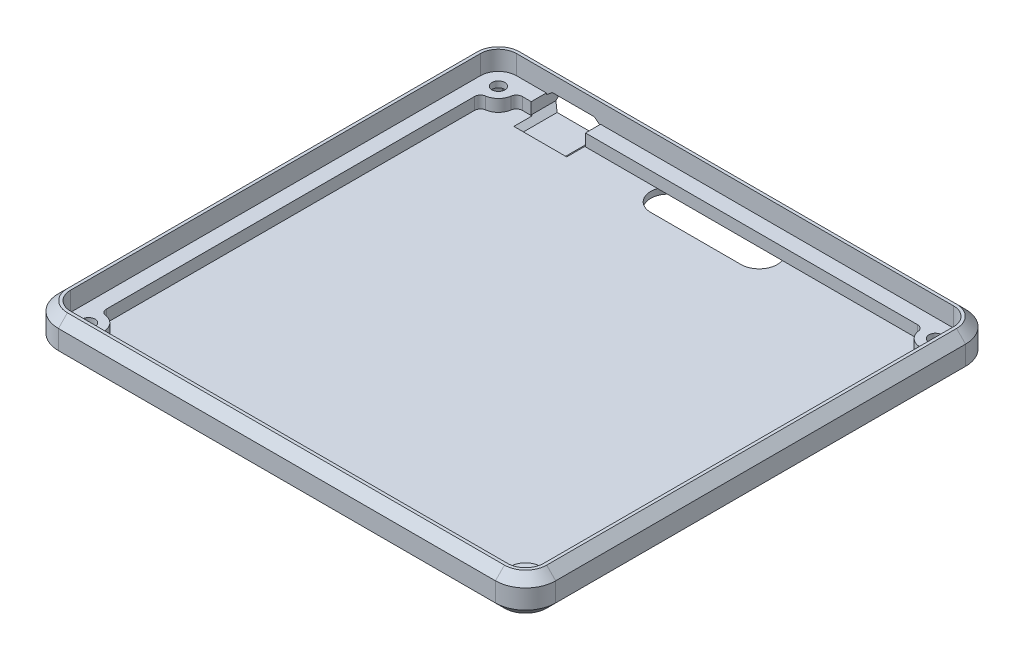
from build123d import *

# Parameters (mm, degrees)
BOSS_EXTRUDE2_DEPTH      = 2
BOSS_EXTRUDE3_DEPTH      = 4
BOSS_EXTRUDE3_DEPTH_BACK = 2
SKETCH3_R                = 2.15
BOSS_EXTRUDE4_DEPTH      = 6.38
CUT_EXTRUDE1_DEPTH       = 15
FILLET1_R                = 2
CUT_EXTRUDE3_DEPTH       = 115.008747033
CUT_EXTRUDE3_DEPTH_BACK  = 115.008747033
SKETCH11_R               = 2.15
CUT_EXTRUDE2_DEPTH       = 4
CHAMFER1_SIZE            = 3
SKETCH13_W               = 18
SKETCH13_H               = 5
CUT_EXTRUDE5_DEPTH       = 1
CUT_EXTRUDE6_DEPTH       = 1
CUT_EXTRUDE7_DEPTH       = 2


with BuildPart() as part:
    # Sketch2 → Boss-Extrude2 (new body)
    with BuildSketch(Plane(origin=(0, 0, 0), x_dir=(1, 0, 0), z_dir=(0, 1, 0))):
        with BuildLine():
            Line((-72.5, 74), (72.5, 74))
            ThreePointArc((72.5, 74), (76.742640687, 72.242640687), (78.5, 68))
            Line((78.5, 68), (78.5, -68))
            ThreePointArc((78.5, -68), (76.742640687, -72.242640687), (72.5, -74))
            Line((72.5, -74), (-72.5, -74))
            ThreePointArc((-72.5, -74), (-76.742640687, -72.242640687), (-78.5, -68))
            Line((-78.5, -68), (-78.5, 68))
            ThreePointArc((-78.5, 68), (-76.742640687, 72.242640687), (-72.5, 74))
        make_face()
    extrude(amount=BOSS_EXTRUDE2_DEPTH)

    # Sketch3 → Boss-Extrude3 (add, two sides: drawn at the far end of the back side and taken through both)
    with BuildSketch(Plane(origin=(0, 2, 0), x_dir=(1, 0, 0), z_dir=(0, 1, 0)).offset(-BOSS_EXTRUDE3_DEPTH_BACK)):
        with BuildLine():
            Line((-82.5, 68), (-82.5, -68))
            ThreePointArc((-82.5, -68), (-79.571067812, -75.071067812), (-72.5, -78))
            Line((-72.5, -78), (72.5, -78))
            ThreePointArc((72.5, -78), (79.571067812, -75.071067812), (82.5, -68))
            Line((82.5, -68), (82.5, 68))
            ThreePointArc((82.5, 68), (79.571067812, 75.071067812), (72.5, 78))
            Line((72.5, 78), (-72.5, 78))
            ThreePointArc((-72.5, 78), (-79.571067812, 75.071067812), (-82.5, 68))
        make_face()
        with Locations(Location((-72.5, -68, 0), (0, 0, 270))):
            Circle(SKETCH3_R, mode=Mode.SUBTRACT)
        with Locations(Location((72.5, -68, 0), (0, 0, 270))):
            Circle(SKETCH3_R, mode=Mode.SUBTRACT)
        with Locations(Location((72.5, 68, 0), (0, 0, 270))):
            Circle(SKETCH3_R, mode=Mode.SUBTRACT)
        with Locations(Location((-72.5, 68, 0), (0, 0, 270))):
            Circle(SKETCH3_R, mode=Mode.SUBTRACT)
        with BuildLine():
            Line((-73.5, 63), (-73.5, -63))
            Line((-73.5, -63), (-72.5, -63))
            ThreePointArc((-72.5, -63), (-68.964466094, -64.464466094), (-67.5, -68))
            Line((-67.5, -68), (-67.5, -69))
            Line((-67.5, -69), (67.5, -69))
            Line((67.5, -69), (67.5, -68))
            ThreePointArc((67.5, -68), (68.964466094, -64.464466094), (72.5, -63))
            Line((72.5, -63), (73.5, -63))
            Line((73.5, -63), (73.5, 63))
            Line((73.5, 63), (72.5, 63))
            ThreePointArc((72.5, 63), (68.964466094, 64.464466094), (67.5, 68))
            Line((67.5, 68), (67.5, 69))
            Line((67.5, 69), (-67.5, 69))
            Line((-67.5, 69), (-67.5, 68))
            ThreePointArc((-67.5, 68), (-68.964466094, 64.464466094), (-72.5, 63))
            Line((-72.5, 63), (-73.5, 63))
        make_face(mode=Mode.SUBTRACT)
    extrude(amount=BOSS_EXTRUDE3_DEPTH + BOSS_EXTRUDE3_DEPTH_BACK)

    # Sketch8 → Boss-Extrude4 (add)
    with BuildSketch(Plane(origin=(0, 6, 0), x_dir=(1, 0, 0), z_dir=(0, 1, 0))):
        with BuildLine():
            ThreePointArc((82.5, 68), (79.571067812, 75.071067812), (72.5, 78))
            Line((72.5, 78), (-72.5, 78))
            ThreePointArc((-72.5, 78), (-79.571067812, 75.071067812), (-82.5, 68))
            Line((-82.5, 68), (-82.5, -68))
            ThreePointArc((-82.5, -68), (-79.571067812, -75.071067812), (-72.5, -78))
            Line((-72.5, -78), (72.5, -78))
            ThreePointArc((72.5, -78), (79.571067812, -75.071067812), (82.5, -68))
            Line((82.5, -68), (82.5, 68))
        make_face()
        with BuildLine():
            ThreePointArc((72.5, -74), (76.742640687, -72.242640687), (78.5, -68))
            Line((78.5, -68), (78.5, 68))
            ThreePointArc((78.5, 68), (76.742640687, 72.242640687), (72.5, 74))
            Line((72.5, 74), (-72.5, 74))
            ThreePointArc((-72.5, 74), (-76.742640687, 72.242640687), (-78.5, 68))
            Line((-78.5, 68), (-78.5, -68))
            ThreePointArc((-78.5, -68), (-76.742640687, -72.242640687), (-72.5, -74))
            Line((-72.5, -74), (72.5, -74))
        make_face(mode=Mode.SUBTRACT)
    extrude(amount=BOSS_EXTRUDE4_DEPTH)

    # Sketch9 → Cut-Extrude1 (cut)
    with BuildSketch(Plane(origin=(0, 0, -78), x_dir=(-1, 0, 0), z_dir=(0, 0, -1))):
        Polygon((60.62, 7.11), (46.62, 7.11), (44.62, 5.51), (44.62, 2.19), (46.62, 0.59), (60.62, 0.59), (62.62, 2.19), (62.62, 5.51), align=None)
    extrude(amount=-CUT_EXTRUDE1_DEPTH, mode=Mode.SUBTRACT)

    # Fillet1
    fillet1_edges = [part.edges().sort_by_distance(p)[0] for p in [
        (-67.5, 4, -69),
        (-73.5, 4, -63),
        (-73.5, 4, 63),
        (-67.5, 4, 69),
        (73.5, 4, 63),
        (67.5, 4, 69),
        (67.5, 4, -69),
        (73.5, 4, -63),
    ]]
    fillet(fillet1_edges, radius=FILLET1_R)

    # Sketch11 → Cut-Extrude3 (cut, two sides: drawn at the far end of the back side and taken through both)
    with BuildSketch(Plane(origin=(0, 2, 0), x_dir=(1, 0, 0), z_dir=(0, 1, 0)).offset(-CUT_EXTRUDE3_DEPTH_BACK)):
        with Locations(Location((-72.5, -68, 0), (0, 0, 270))):
            Circle(SKETCH11_R)
        with Locations(Location((72.5, -68, 0), (0, 0, 270))):
            Circle(SKETCH11_R)
        with Locations(Location((72.5, 68, 0), (0, 0, 270))):
            Circle(SKETCH11_R)
        with Locations(Location((-72.5, 68, 0), (0, 0, 270))):
            Circle(SKETCH11_R)
    extrude(amount=CUT_EXTRUDE3_DEPTH + CUT_EXTRUDE3_DEPTH_BACK, mode=Mode.SUBTRACT)

    # Sketch10 → Cut-Extrude2 (cut)
    with BuildSketch(Plane.XZ):
        Polygon((-74.520725942, 64.5), (-70.479274058, 64.5), (-68.458548116, 68), (-70.479274058, 71.5), (-74.520725942, 71.5), (-76.541451884, 68), align=None)
        Polygon((76.541451884, 68), (74.520725942, 64.5), (70.479274058, 64.5), (68.458548116, 68), (70.479274058, 71.5), (74.520725942, 71.5), align=None)
        Polygon((-70.479274058, -64.5), (-68.458548116, -68), (-70.479274058, -71.5), (-74.520725942, -71.5), (-76.541451884, -68), (-74.520725942, -64.5), align=None)
        Polygon((76.541451884, -68), (74.520725942, -64.5), (70.479274058, -64.5), (68.458548116, -68), (70.479274058, -71.5), (74.520725942, -71.5), align=None)
    extrude(amount=-CUT_EXTRUDE2_DEPTH, mode=Mode.SUBTRACT)

    # Chamfer1
    # the kernel refuses this chamfer: 3 mm, written as the material it takes off along each edge
    with BuildSketch(Plane(origin=(-72.5, 12.38, 68), x_dir=(-1, 0, 0), z_dir=(0, 0, -1))) as chamfer1_piece_1:
        Polygon((10 - CHAMFER1_SIZE, 0), (10, -CHAMFER1_SIZE), (10, 0), align=None)
    revolve(axis=Axis((-72.5, 12.38, 68), (0, 1, 0)), revolution_arc=90, mode=Mode.SUBTRACT)
    with BuildSketch(Plane(origin=(-72.5, 12.38, 78), x_dir=(0, 0.02749587661058619, -0.9996219169112968), z_dir=(1, 0, 0)), Plane(origin=(72.5, 0, -78), x_dir=(0, 0.9996219169112968, -0.027495876610586778), z_dir=(-1, 0, 0))) as chamfer1_piece_2:
        Polygon((CHAMFER1_SIZE * 0.999621916911, -CHAMFER1_SIZE * 0.0274958766106), (-CHAMFER1_SIZE * 0.0274958766106, -CHAMFER1_SIZE * 0.999621916911), (0, 0), align=None)
    extrude(amount=145, mode=Mode.SUBTRACT)
    with BuildSketch(Plane(origin=(72.5, 12.38, 68), x_dir=(0, 0, 1), z_dir=(-1, 0, 0))) as chamfer1_piece_3:
        Polygon((10 - CHAMFER1_SIZE, 0), (10, -CHAMFER1_SIZE), (10, 0), align=None)
    revolve(axis=Axis((72.5, 12.38, 68), (0, 1, 0)), revolution_arc=90, mode=Mode.SUBTRACT)
    with BuildSketch(Plane(origin=(82.5, 12.38, 68), x_dir=(-0.9996219169112968, 0.02749587661058619, 0), z_dir=(0, 0, -1)), Plane(origin=(-82.5, 12.38, -68), x_dir=(0.9996219169112968, 0.02749587661058619, 0), z_dir=(0, 0, 1))) as chamfer1_piece_4:
        Polygon((CHAMFER1_SIZE * 0.999621916911, -CHAMFER1_SIZE * 0.0274958766106), (-CHAMFER1_SIZE * 0.0274958766106, -CHAMFER1_SIZE * 0.999621916911), (0, 0), align=None)
    extrude(amount=136, mode=Mode.SUBTRACT)
    with BuildSketch(Plane(origin=(72.5, 12.38, -68), x_dir=(1, 0, 0), z_dir=(0, 0, 1))) as chamfer1_piece_5:
        Polygon((10 - CHAMFER1_SIZE, 0), (10, -CHAMFER1_SIZE), (10, 0), align=None)
    revolve(axis=Axis((72.5, 12.38, -68), (0, 1, 0)), revolution_arc=90, mode=Mode.SUBTRACT)
    with BuildSketch(Plane(origin=(72.5, 12.38, -78), x_dir=(0, -0.9996219169112968, -0.02749587661058678), z_dir=(-1, 0, 0)), Plane(origin=(-72.5, 0, 78), x_dir=(0, -0.02749587661058636, -0.9996219169112968), z_dir=(1, 0, 0))) as chamfer1_piece_6:
        Polygon((CHAMFER1_SIZE * 0.999621916911, CHAMFER1_SIZE * 0.0274958766106), (-CHAMFER1_SIZE * 0.0274958766106, CHAMFER1_SIZE * 0.999621916911), (0, 0), align=None)
    extrude(amount=145, mode=Mode.SUBTRACT)
    with BuildSketch(Plane(origin=(-72.5, 12.38, -68), x_dir=(0, 0, -1), z_dir=(1, 0, 0))) as chamfer1_piece_7:
        Polygon((10 - CHAMFER1_SIZE, 0), (10, -CHAMFER1_SIZE), (10, 0), align=None)
    revolve(axis=Axis((-72.5, 12.38, -68), (0, 1, 0)), revolution_arc=90, mode=Mode.SUBTRACT)
    with BuildSketch(Plane(origin=(-72.5, 0, -68), x_dir=(0, 0, -1), z_dir=(1, 0, 0))) as chamfer1_piece_8:
        Polygon((10 - CHAMFER1_SIZE, 0), (10, CHAMFER1_SIZE), (10, 0), align=None)
    revolve(axis=Axis((-72.5, 0, -68), (0, 1, 0)), revolution_arc=90, mode=Mode.SUBTRACT)
    with BuildSketch(Plane(origin=(-82.5, 0, -68), x_dir=(0.9996219169112968, -0.02749587661058636, 0), z_dir=(0, 0, 1)), Plane(origin=(82.5, 0, 68), x_dir=(-0.9996219169112968, -0.02749587661058636, 0), z_dir=(0, 0, -1))) as chamfer1_piece_9:
        Polygon((CHAMFER1_SIZE * 0.999621916911, CHAMFER1_SIZE * 0.0274958766106), (-CHAMFER1_SIZE * 0.0274958766106, CHAMFER1_SIZE * 0.999621916911), (0, 0), align=None)
    extrude(amount=136, mode=Mode.SUBTRACT)
    with BuildSketch(Plane(origin=(-72.5, 0, 68), x_dir=(-1, 0, 0), z_dir=(0, 0, -1))) as chamfer1_piece_10:
        Polygon((10 - CHAMFER1_SIZE, 0), (10, CHAMFER1_SIZE), (10, 0), align=None)
    revolve(axis=Axis((-72.5, 0, 68), (0, 1, 0)), revolution_arc=90, mode=Mode.SUBTRACT)
    with BuildSketch(Plane(origin=(72.5, 0, 68), x_dir=(0, 0, 1), z_dir=(-1, 0, 0))) as chamfer1_piece_11:
        Polygon((10 - CHAMFER1_SIZE, 0), (10, CHAMFER1_SIZE), (10, 0), align=None)
    revolve(axis=Axis((72.5, 0, 68), (0, 1, 0)), revolution_arc=90, mode=Mode.SUBTRACT)
    with BuildSketch(Plane(origin=(72.5, 0, -68), x_dir=(1, 0, 0), z_dir=(0, 0, 1))) as chamfer1_piece_12:
        Polygon((10, CHAMFER1_SIZE), (10 - CHAMFER1_SIZE, 0), (10, 0), align=None)
    revolve(axis=Axis((72.5, 0, -68), (0, 1, 0)), revolution_arc=90, mode=Mode.SUBTRACT)

    # Sketch13 → Cut-Extrude5 (cut)
    with BuildSketch(Plane(origin=(0, 6, 0), x_dir=(1, 0, 0), z_dir=(0, 1, 0))):
        with Locations((-53.62, 71.5)):
            Rectangle(SKETCH13_W, SKETCH13_H)
    extrude(amount=-CUT_EXTRUDE5_DEPTH, mode=Mode.SUBTRACT)

    # Sketch14 → Cut-Extrude6 (cut)
    with BuildSketch(Plane.XZ):
        with BuildLine():
            Line((-62, -41), (-52, -41))
            ThreePointArc((-52, -41), (-48.464466094, -42.464466094), (-47, -46))
            Line((-47, -46), (-47, -56))
            ThreePointArc((-47, -56), (-48.464466094, -59.535533906), (-52, -61))
            Line((-52, -61), (-62, -61))
            ThreePointArc((-62, -61), (-65.535533906, -59.535533906), (-67, -56))
            Line((-67, -56), (-67, -46))
            ThreePointArc((-67, -46), (-65.535533906, -42.464466094), (-62, -41))
        make_face()
        with BuildLine():
            Line((62, -61), (52, -61))
            ThreePointArc((52, -61), (48.464466094, -59.535533906), (47, -56))
            Line((47, -56), (47, -46))
            ThreePointArc((47, -46), (48.464466094, -42.464466094), (52, -41))
            Line((52, -41), (62, -41))
            ThreePointArc((62, -41), (65.535533906, -42.464466094), (67, -46))
            Line((67, -46), (67, -56))
            ThreePointArc((67, -56), (65.535533906, -59.535533906), (62, -61))
        make_face()
    extrude(amount=-CUT_EXTRUDE6_DEPTH, mode=Mode.SUBTRACT)

    # Sketch15 → Cut-Extrude7 (cut)
    with BuildSketch(Plane.XZ):
        with BuildLine():
            Line((-15, -61), (15, -61))
            ThreePointArc((15, -61), (21, -67), (15, -73))
            Line((15, -73), (-15, -73))
            ThreePointArc((-15, -73), (-21, -67), (-15, -61))
        make_face()
    extrude(amount=-CUT_EXTRUDE7_DEPTH, mode=Mode.SUBTRACT)


solid = part.part
